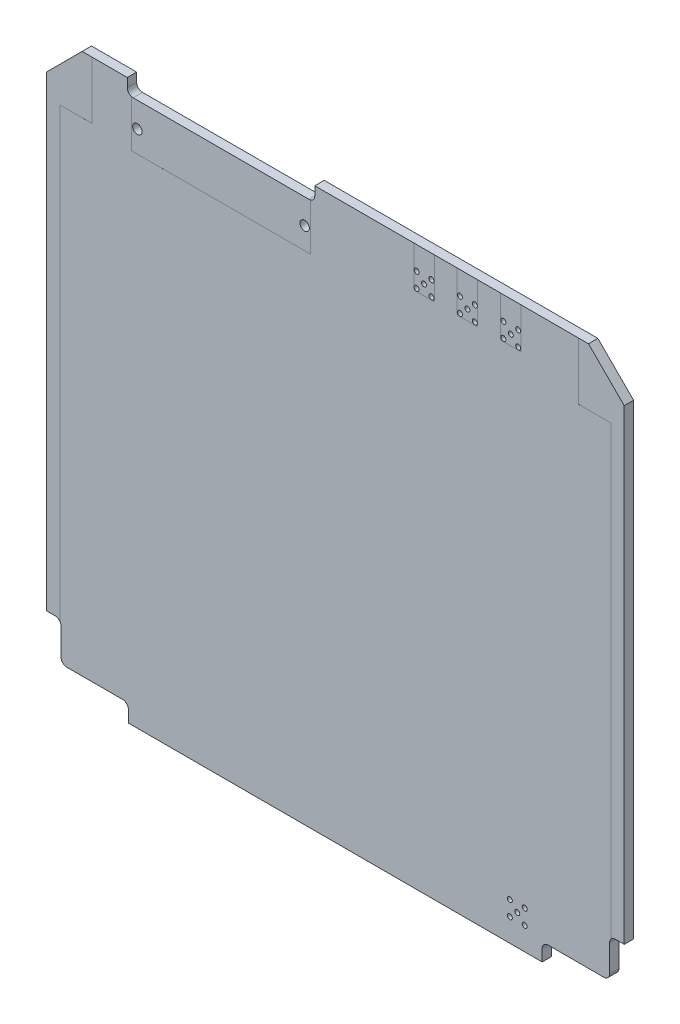
from build123d import *

# Parameters (mm, degrees)
SKETCH1_R           = 0.425
SKETCH1_R_2         = 0.8
BOSS_EXTRUDE1_DEPTH = 1.6
CUT_EXTRUDE1_DEPTH  = 0.0001
CUT_EXTRUDE2_DEPTH  = 0.0001
PARTFOOTPRINTS_W    = 30.48
PARTFOOTPRINTS_H    = 7.989227112
PARTFOOTPRINTS_W_2  = 3.5
PARTFOOTPRINTS_H_2  = 6.95
CUT_EXTRUDE3_DEPTH  = 0.0001
SKETCH2_R           = 0.425
CUT_EXTRUDE4_DEPTH  = 71.235674696


with BuildPart() as part:
    # Sketch1 → Boss-Extrude1 (new body)
    with BuildSketch(Plane(origin=(0, 0, -0.0125), x_dir=(-1, 0, 0), z_dir=(0, 0, -1))):
        with BuildLine():
            Line((35.3, -50), (35.3, -48))
            ThreePointArc((35.3, -48), (35.592893219, -47.292893219), (36.3, -47))
            Line((36.3, -47), (45.8, -47))
            ThreePointArc((45.8, -47), (46.507106781, -46.707106781), (46.8, -46))
            Line((46.8, -46), (46.8, -41.4))
            ThreePointArc((46.8, -41.4), (47.092893219, -40.692893219), (47.8, -40.4))
            Line((47.8, -40.4), (49.3, -40.4))
            Line((49.3, -40.4), (49.3, 39.2))
            Line((49.3, 39.2), (43.2, 45.3))
            Line((43.2, 45.3), (35.500000002, 45.3))
            Line((35.500000002, 45.3), (35.500000002, 43.8))
            ThreePointArc((35.500000002, 43.8), (35.207106783, 43.092893219), (34.500000002, 42.8))
            Line((34.500000002, 42.8), (4.499999998, 42.8))
            ThreePointArc((4.499999998, 42.8), (3.792893217, 43.092893219), (3.499999998, 43.8))
            Line((3.499999998, 43.8), (3.499999998, 45.3))
            Line((3.499999998, 45.3), (-43.2, 45.3))
            Line((-43.2, 45.3), (-49.3, 39.2))
            Line((-49.3, 39.2), (-49.3, -40.4))
            Line((-49.3, -40.4), (-47.8, -40.4))
            ThreePointArc((-47.8, -40.4), (-47.092893219, -40.692893219), (-46.8, -41.4))
            Line((-46.8, -41.4), (-46.8, -46))
            ThreePointArc((-46.8, -46), (-46.507106781, -46.707106781), (-45.8, -47))
            Line((-45.8, -47), (-36.3, -47))
            ThreePointArc((-36.3, -47), (-35.592893219, -47.292893219), (-35.3, -48))
            Line((-35.3, -48), (-35.3, -50))
            Line((-35.3, -50), (35.3, -50))
        make_face()
        with Locations((-21.27, 41.37)):
            Circle(SKETCH1_R, mode=Mode.SUBTRACT)
        with Locations((-23.81, 41.37)):
            Circle(SKETCH1_R, mode=Mode.SUBTRACT)
        with Locations((-22.54, 40.1)):
            Circle(SKETCH1_R, mode=Mode.SUBTRACT)
        with Locations((-13.87, 41.37)):
            Circle(SKETCH1_R, mode=Mode.SUBTRACT)
        with Locations((-23.81, 38.83)):
            Circle(SKETCH1_R, mode=Mode.SUBTRACT)
        with Locations((-16.41, 41.37)):
            Circle(SKETCH1_R, mode=Mode.SUBTRACT)
        with Locations((-15.14, 40.1)):
            Circle(SKETCH1_R, mode=Mode.SUBTRACT)
        with Locations((-21.27, 38.83)):
            Circle(SKETCH1_R, mode=Mode.SUBTRACT)
        with Locations((-28.67, 41.37)):
            Circle(SKETCH1_R, mode=Mode.SUBTRACT)
        with Locations((-31.21, 41.37)):
            Circle(SKETCH1_R, mode=Mode.SUBTRACT)
        with Locations((-16.41, 38.83)):
            Circle(SKETCH1_R, mode=Mode.SUBTRACT)
        with Locations((-29.94, 40.1)):
            Circle(SKETCH1_R, mode=Mode.SUBTRACT)
        with Locations((-31.21, 38.83)):
            Circle(SKETCH1_R, mode=Mode.SUBTRACT)
        with Locations((-28.67, 38.83)):
            Circle(SKETCH1_R, mode=Mode.SUBTRACT)
        with Locations((33.775, 38.54)):
            Circle(SKETCH1_R_2, mode=Mode.SUBTRACT)
        with Locations((5.225, 38.54)):
            Circle(SKETCH1_R_2, mode=Mode.SUBTRACT)
        with Locations((-13.87, 38.83)):
            Circle(SKETCH1_R, mode=Mode.SUBTRACT)
    extrude(amount=-BOSS_EXTRUDE1_DEPTH)

    # thermalContacts_lower → Cut-Extrude1 (cut)
    with BuildSketch(Plane(origin=(0, 0, -0.0125), x_dir=(-1, 0, 0), z_dir=(0, 0, -1))):
        Polygon((47, 35.5), (47, -41.5), (59.827263463, -41.5), (59.827263463, 47), (41.5, 47), (41.5, 41.5), (41.5, 35.5), align=None)
        Polygon((-47, 35.5), (-47, -41.5), (-56.192158269, -41.5), (-56.192158269, 47), (-41.5, 47), (-41.5, 41.5), (-41.5, 35.5), align=None)
    extrude(amount=-CUT_EXTRUDE1_DEPTH, mode=Mode.SUBTRACT)

    # thermalContacts_upper → Cut-Extrude2 (cut)
    with BuildSketch(Plane.XY.offset(1.5875)):
        Polygon((-47, 35.5), (-47, -41.5), (-56.192158269, -41.5), (-56.192158269, 47), (-41.5, 47), (-41.5, 41.5), (-41.5, 35.5), align=None)
        Polygon((47, 35.5), (47, -41.5), (59.827263463, -41.5), (59.827263463, 47), (41.5, 47), (41.5, 41.5), (41.5, 35.5), align=None)
    extrude(amount=-CUT_EXTRUDE2_DEPTH, mode=Mode.SUBTRACT)

    # partFootprints → Cut-Extrude3 (cut)
    with BuildSketch(Plane.XY.offset(1.5875)):
        with Locations((-19.5, 38.834613556)):
            Rectangle(PARTFOOTPRINTS_W, PARTFOOTPRINTS_H)
        with Locations((15.14, 41.825)):
            Rectangle(PARTFOOTPRINTS_W_2, PARTFOOTPRINTS_H_2)
        with Locations((22.54, 41.825)):
            Rectangle(PARTFOOTPRINTS_W_2, PARTFOOTPRINTS_H_2)
        with Locations((29.94, 41.825)):
            Rectangle(PARTFOOTPRINTS_W_2, PARTFOOTPRINTS_H_2)
    extrude(amount=-CUT_EXTRUDE3_DEPTH, mode=Mode.SUBTRACT)

    # Sketch2 → Cut-Extrude4 (cut, through all)
    with BuildSketch(Plane.XY.offset(1.5875)):
        with Locations((32.32, -43.53)):
            Circle(SKETCH2_R)
        with Locations((29.78, -43.53)):
            Circle(SKETCH2_R)
        with Locations((31.05, -44.8)):
            Circle(SKETCH2_R)
        with Locations((29.78, -46.07)):
            Circle(SKETCH2_R)
        with Locations((32.32, -46.07)):
            Circle(SKETCH2_R)
    extrude(amount=-CUT_EXTRUDE4_DEPTH, mode=Mode.SUBTRACT)


solid = part.part
